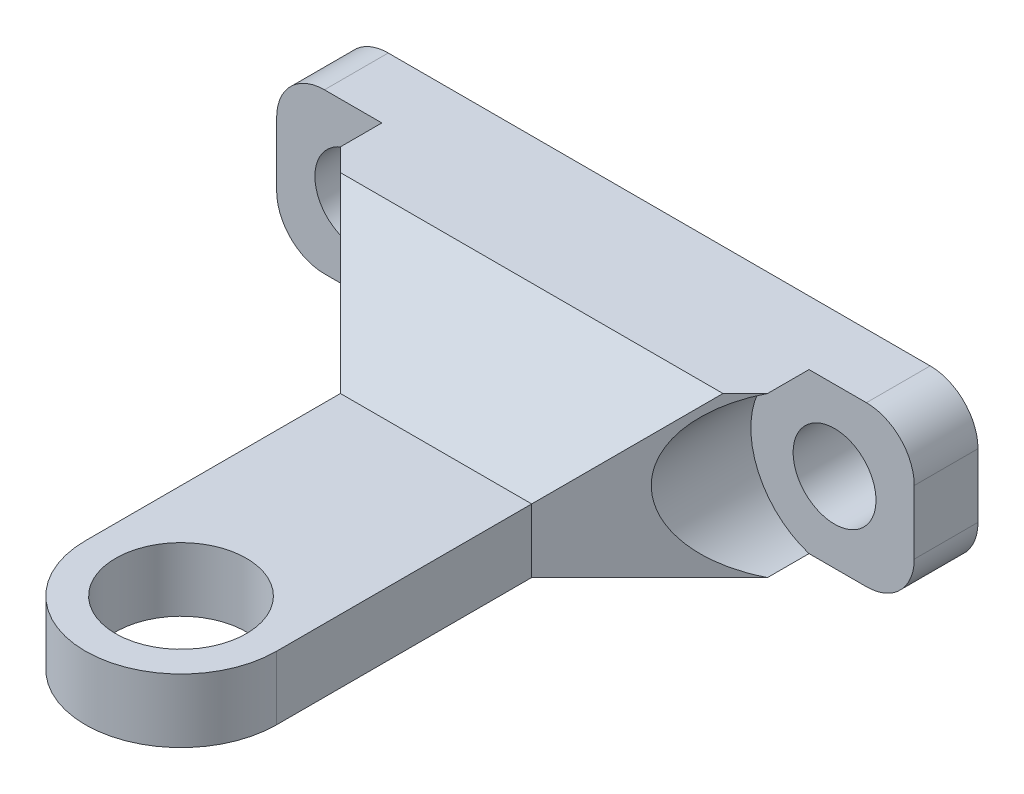
from build123d import *

# Parameters (mm, degrees)
ESBO_O1_R                = 6
ESBO_O1_R_2              = 4.1
RESSALTO_EXTRUS_O1_DEPTH = 2
ESBO_O2_W                = 40
ESBO_O2_H                = 4
RESSALTO_EXTRUS_O2_DEPTH = 6
CHANFRO3_SIZE            = 10
CHANFRO4_SIZE            = 10
CHANFRO5_SIZE            = 10
ESBO_O6_R                = 2.6
CORTE_EXTRUS_O2_DEPTH    = 39.574603044
ESBO_O7_R                = 5.25
CORTE_EXTRUS_O6_DEPTH    = 39.574603044
FILETE1_R                = 3


with BuildPart() as part:
    # Esboço1 → Ressalto-extrusão1 (new, symmetric)
    # profile 1 of 3: a face of its own
    with BuildSketch(Plane(origin=(0, 0, 0), x_dir=(1, 0, 0), z_dir=(0, 1, 0))):
        Polygon((20, 18), (-20, 18), (-20, 14), (-6, 14), (6, 14), (20, 14), align=None)
    # profile 2 of 3: a face of its own
    with BuildSketch(Plane(origin=(0, 0, 0), x_dir=(1, 0, 0), z_dir=(0, 1, 0))):
        with BuildLine():
            Line((6, 14), (-6, 14))
            Line((-6, 14), (-6, -12))
            ThreePointArc((-6, -12), (0, -6), (6, -12))
            Line((6, -12), (6, 14))
        make_face()
    # profile 3 of 3: a face of its own
    with BuildSketch(Plane(origin=(0, 0, 0), x_dir=(1, 0, 0), z_dir=(0, 1, 0))):
        with Locations((0, -12)):
            Circle(ESBO_O1_R)
        with Locations(Location((0, -12, 0), (0, 0, 270))):
            Circle(ESBO_O1_R_2, mode=Mode.SUBTRACT)
    extrude(amount=RESSALTO_EXTRUS_O1_DEPTH, both=True)

    # Esboço2 → Ressalto-extrusão2 (add)
    with BuildSketch(Plane(origin=(0, 2, 0), x_dir=(1, 0, 0), z_dir=(0, 1, 0))):
        with Locations((0, 16)):
            Rectangle(ESBO_O2_W, ESBO_O2_H)
    extrude(amount=RESSALTO_EXTRUS_O2_DEPTH)

    # Chanfro3
    chanfro3_edges = [part.edges().sort_by_distance(p)[0] for p in [
        (6, 0, -14),
    ]]
    chamfer(chanfro3_edges, length=CHANFRO3_SIZE)

    # Chanfro4
    chanfro4_edges = [part.edges().sort_by_distance(p)[0] for p in [
        (-6, 0, -14),
    ]]
    chamfer(chanfro4_edges, length=CHANFRO4_SIZE)

    # Chanfro5
    # the kernel refuses this chamfer: 10 mm, written as the material it adds along each edge
    with BuildSketch(Plane(origin=(-41.71682988, 2, -14), x_dir=(0, 0.9996219169112968, -0.027495876610586317), z_dir=(1, 0, 0))) as chanfro5_piece_1_section:
        Polygon((CHANFRO5_SIZE * 0.999621916911, CHANFRO5_SIZE * 0.0274958766106), (-CHANFRO5_SIZE * 0.0274958766106, CHANFRO5_SIZE * 0.999621916911), (0, 0), align=None)
    chanfro5_piece_1 = extrude(amount=83.433659759, mode=Mode.PRIVATE)
    chanfro5_piece_1 = split(chanfro5_piece_1, bisect_by=Plane(origin=(-11.43705518, 4.703831668, -9.43705518), z_dir=(0.7071067811865475, 0, -0.7071067811865476)), keep=Keep.TOP, mode=Mode.PRIVATE)
    chanfro5_piece_1 = split(chanfro5_piece_1, bisect_by=Plane(origin=(-9.624703453, 8, -11.249406907), z_dir=(0, -1, 0)), keep=Keep.TOP, mode=Mode.PRIVATE)
    chanfro5_piece_1 = split(chanfro5_piece_1, bisect_by=Plane(origin=(-6, 4.703831668, -11.249406907), z_dir=(-1, 0, 0)), keep=Keep.TOP, mode=Mode.PRIVATE)
    add(chanfro5_piece_1)
    with BuildSketch(Plane(origin=(-41.71682988, 2, -14), x_dir=(0, 0.9996219169112968, -0.027495876610586317), z_dir=(1, 0, 0))) as chanfro5_piece_2_section:
        Polygon((CHANFRO5_SIZE * 0.999621916911, CHANFRO5_SIZE * 0.0274958766106), (-CHANFRO5_SIZE * 0.0274958766106, CHANFRO5_SIZE * 0.999621916911), (0, 0), align=None)
    chanfro5_piece_2 = extrude(amount=83.433659759, mode=Mode.PRIVATE)
    chanfro5_piece_2 = split(chanfro5_piece_2, bisect_by=Plane(origin=(-6.125087245, 4.433681659, -4.125087245), z_dir=(0.7071067811865475, 0, -0.7071067811865476)), keep=Keep.TOP, mode=Mode.PRIVATE)
    chanfro5_piece_2 = split(chanfro5_piece_2, bisect_by=Plane(origin=(6.125087245, 4.433681659, -4.125087245), z_dir=(-0.7071067811865477, 0, -0.7071067811865474)), keep=Keep.TOP, mode=Mode.PRIVATE)
    chanfro5_piece_2 = split(chanfro5_piece_2, bisect_by=Plane(origin=(0, 8, -10.250174491), z_dir=(0, -1, 0)), keep=Keep.TOP, mode=Mode.PRIVATE)
    chanfro5_piece_2 = split(chanfro5_piece_2, bisect_by=Plane(origin=(6, 4.433681659, -10.250174491), z_dir=(-1, 0, 0)), keep=Keep.TOP, mode=Mode.PRIVATE)
    chanfro5_piece_2 = split(chanfro5_piece_2, bisect_by=Plane(origin=(-6, 4.433681659, -10.250174491), z_dir=(1, 0, 0)), keep=Keep.TOP, mode=Mode.PRIVATE)
    add(chanfro5_piece_2)
    with BuildSketch(Plane(origin=(-41.71682988, 2, -14), x_dir=(0, 0.9996219169112968, -0.027495876610586317), z_dir=(1, 0, 0))) as chanfro5_piece_3_section:
        Polygon((CHANFRO5_SIZE * 0.999621916911, CHANFRO5_SIZE * 0.0274958766106), (-CHANFRO5_SIZE * 0.0274958766106, CHANFRO5_SIZE * 0.999621916911), (0, 0), align=None)
    chanfro5_piece_3 = extrude(amount=83.433659759, mode=Mode.PRIVATE)
    chanfro5_piece_3 = split(chanfro5_piece_3, bisect_by=Plane(origin=(11.43705518, 4.703831668, -9.43705518), z_dir=(-0.7071067811865477, 0, -0.7071067811865474)), keep=Keep.TOP, mode=Mode.PRIVATE)
    chanfro5_piece_3 = split(chanfro5_piece_3, bisect_by=Plane(origin=(9.624703453, 8, -11.249406907), z_dir=(0, -1, 0)), keep=Keep.TOP, mode=Mode.PRIVATE)
    chanfro5_piece_3 = split(chanfro5_piece_3, bisect_by=Plane(origin=(6, 4.703831668, -11.249406907), z_dir=(1, 0, 0)), keep=Keep.TOP, mode=Mode.PRIVATE)
    add(chanfro5_piece_3)

    # Esboço6 → Corte-extrusão2 (cut, symmetric)
    with BuildSketch(Plane.XY.offset(-14)):
        with Locations((-15, 3)):
            Circle(ESBO_O6_R)
    corte_extrus_o2 = extrude(amount=CORTE_EXTRUS_O2_DEPTH, both=True, mode=Mode.SUBTRACT)

    # Esboço7 → Corte-extrusão6 (cut, through all)
    with BuildSketch(Plane.XY.offset(-14)):
        with Locations((-15, 3)):
            Circle(ESBO_O7_R)
    corte_extrus_o6 = extrude(amount=CORTE_EXTRUS_O6_DEPTH, mode=Mode.SUBTRACT)

    # Espelhar2: Corte-extrusão2, Corte-extrusão6 across plane
    add(corte_extrus_o2.mirror(Plane(origin=(0, 0, 0), x_dir=(0, 0, 1), z_dir=(1, 0, 0))), mode=Mode.SUBTRACT)
    add(corte_extrus_o6.mirror(Plane(origin=(0, 0, 0), x_dir=(0, 0, 1), z_dir=(1, 0, 0))), mode=Mode.SUBTRACT)

    # Filete1
    filete1_edges = [part.edges().sort_by_distance(p)[0] for p in [
        (20, -2, -16),
        (-20, -2, -16),
        (-20, 8, -16),
        (20, 8, -16),
    ]]
    fillet(filete1_edges, radius=FILETE1_R)


solid = part.part
